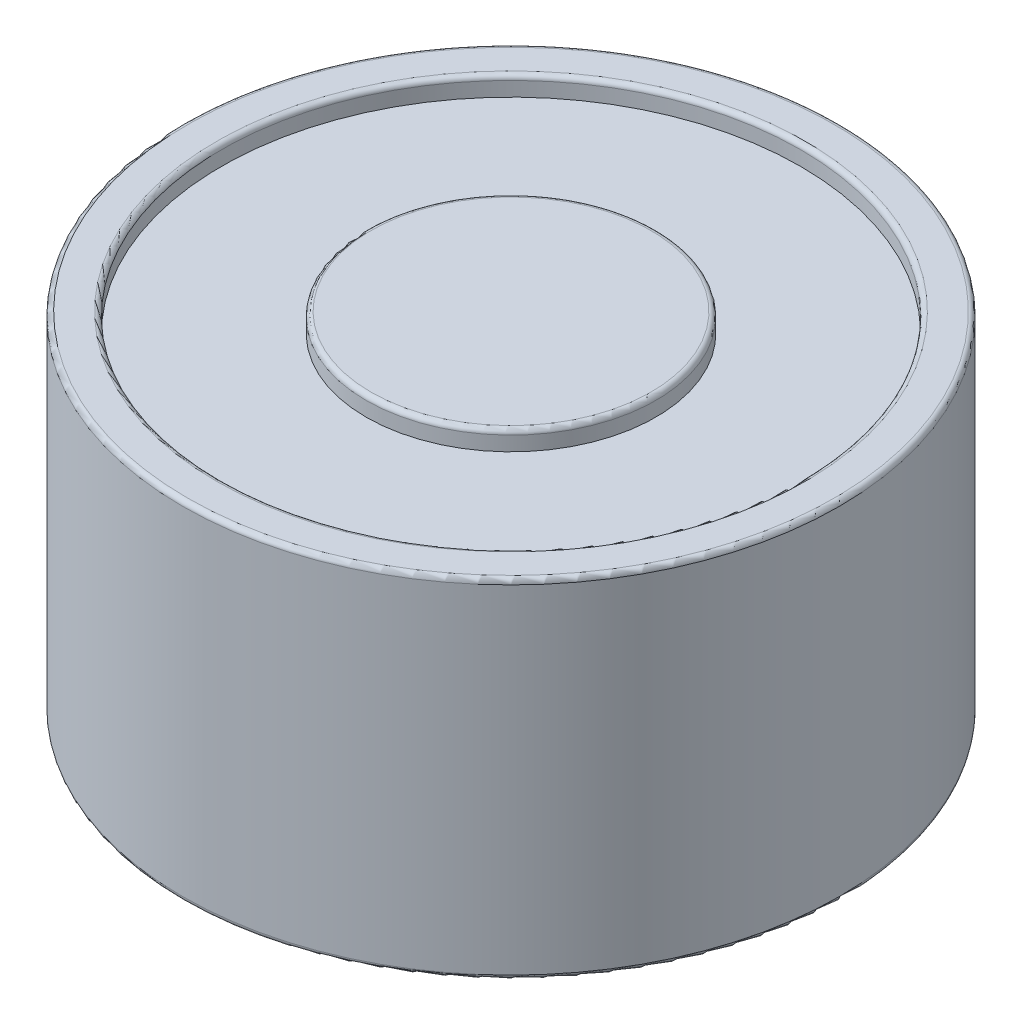
from build123d import *

# Parameters (mm, degrees)
SKETCH_1_R          = 17
EXTRUDE_1_DEPTH     = 18
SKETCH_2_R          = 15
SKETCH_2_R_2        = 7.5
CUT_EXTRUDE_1_DEPTH = 1
SKETCH_3_R          = 2
CUT_EXTRUDE_2_DEPTH = 10
THREAD_1_PITCH      = 0.705555556
FILLET_1_R          = 0.25


with BuildPart() as part:
    # Sketch 1 → 凸台-拉伸1 (new body)
    with BuildSketch(Plane(origin=(0, 0, 0), x_dir=(1, 0, 0), z_dir=(0, 1, 0))):
        with Locations(Location((0, 0, 0), (0, 0, 270))):
            Circle(SKETCH_1_R)
    extrude(amount=EXTRUDE_1_DEPTH)

    # 草图2 → 切除-拉伸1 (cut)
    with BuildSketch(Plane(origin=(0, 18, 0), x_dir=(1, 0, 0), z_dir=(0, 1, 0))):
        with Locations(Location((0, 0, 0), (0, 0, 270))):
            Circle(SKETCH_2_R)
        with Locations(Location((0, 0, 0), (0, 0, 270))):
            Circle(SKETCH_2_R_2, mode=Mode.SUBTRACT)
    extrude(amount=-CUT_EXTRUDE_1_DEPTH, mode=Mode.SUBTRACT)

    # 草图3 → 切除-拉伸2 (cut)
    with BuildSketch(Plane.XZ):
        with Locations(Location((0, 0, 0), (0, 0, 270))):
            Circle(SKETCH_3_R)
    extrude(amount=-CUT_EXTRUDE_2_DEPTH, mode=Mode.SUBTRACT)

    # 螺纹线1: the profile of Sketch 1 2 profile screwed along a right-hand helix of 14.173228 turns, 6 arcs to a turn; built about Z, then put on its axis
    thread_1_z = Axis((0, 0, 0), (0, 0, 1))
    thread_1_corners = [(2.0003, 0, -0.000173205), (2.0003, 0, 0.617534314), (1.618106855, 0, 0.396874999), (1.618106855, 0, 0.22048611)]
    with BuildLine(mode=Mode.PRIVATE) as thread_1_profile:
        Line(thread_1_corners[0], thread_1_corners[1])
        Line(thread_1_corners[1], thread_1_corners[2])
        Line(thread_1_corners[2], thread_1_corners[3])
        Line(thread_1_corners[3], thread_1_corners[0])
    thread_1_cap = Face(thread_1_profile.wire())
    thread_1_turn_angles = [0, 30, 60, 90, 120, 150, 180, 210, 240, 270, 300, 330, 360]
    thread_1_turn_weights = [1, 0.8660254037844387, 1, 0.8660254037844387, 1, 0.8660254037844387, 1, 0.8660254037844387, 1, 0.8660254037844387, 1, 0.8660254037844387, 1]
    thread_1_turn_rails = [Edge.make_bspline([Vector(p[0], p[1], 0).rotate(thread_1_z, thread_1_turn_angles[k]) / thread_1_turn_weights[k] + Vector(0, 0, p[2] + THREAD_1_PITCH * thread_1_turn_angles[k] / 360) for k in range(13)], [0, 0, 0, 1, 1, 2, 2, 3, 3, 4, 4, 5, 5, 6, 6, 6], 2, thread_1_turn_weights) for p in thread_1_corners]
    thread_1_turn_sides = [Face.make_surface_from_curves(thread_1_turn_rails[p[0]], thread_1_turn_rails[p[1]]) for p in [(0, 1), (1, 2), (2, 3), (3, 0)]]
    thread_1_last_angles = [5040, 5070, 5100, 5101.181102362, 5102.362204724]
    thread_1_last_weights = [1, 0.8660254037844387, 1, 0.999787536448644, 1]
    thread_1_last_rails = [Edge.make_bspline([Vector(p[0], p[1], 0).rotate(thread_1_z, thread_1_last_angles[k]) / thread_1_last_weights[k] + Vector(0, 0, p[2] + THREAD_1_PITCH * thread_1_last_angles[k] / 360) for k in range(5)], [0, 0, 0, 1, 1, 2, 2, 2], 2, thread_1_last_weights) for p in thread_1_corners]
    thread_1_last_sides = [Face.make_surface_from_curves(thread_1_last_rails[p[0]], thread_1_last_rails[p[1]]) for p in [(0, 1), (1, 2), (2, 3), (3, 0)]]
    thread_1 = Plane(origin=(0, 0, 0), x_dir=(1, 0, 0), z_dir=(0, 1, 0)) * Solid(Shell([*[p.moved(Location((0, 0, THREAD_1_PITCH * i))) for i in range(14) for p in thread_1_turn_sides], *thread_1_last_sides, thread_1_cap, thread_1_cap.rotate(thread_1_z, 5102.362204724).moved(Location((0, 0, THREAD_1_PITCH * 5102.362204724 / 360)))]))
    add(thread_1)

    # 圆角1
    fillet_1_edges = [part.edges().sort_by_distance(p)[0] for p in [
        (0, 0, -17),
        (0, 18, -17),
        (0, 18, -15),
        (0, 18, -7.5),
    ]]
    fillet(fillet_1_edges, radius=FILLET_1_R)


solid = part.part
